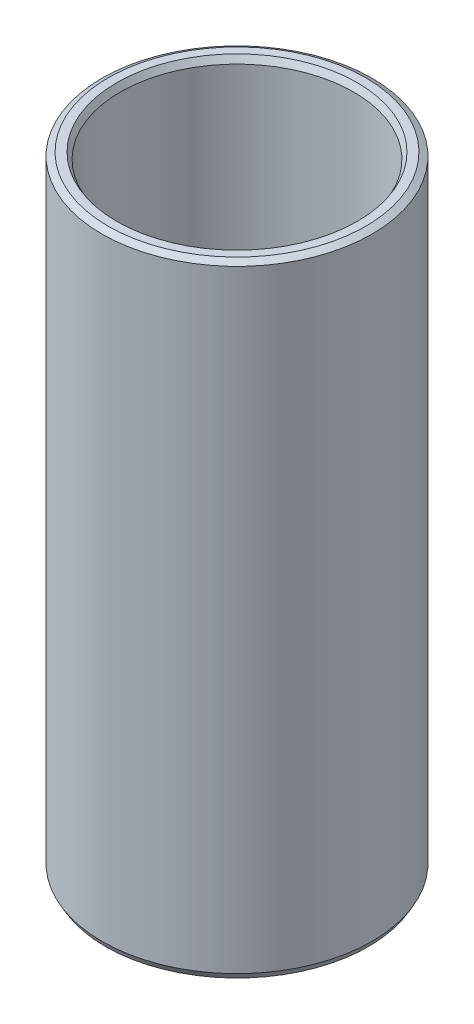
from build123d import *
from OCP.BRepFilletAPI import BRepFilletAPI_MakeChamfer

# Parameters (mm, degrees)
SKETCH1_R           = 47.5
BOSS_EXTRUDE1_DEPTH = 218.951031633
SKETCH2_R           = 41.034381125
CUT_EXTRUDE1_DEPTH  = 230.024134652
CHAMFER1_SIZE       = 1.256157061
CHAMFER1_SIZE2      = 2.228060438


with BuildPart() as part:
    # Sketch1 → Boss-Extrude1 (new body)
    with BuildSketch(Plane(origin=(0, 0, 0), x_dir=(1, 0, 0), z_dir=(0, 1, 0))):
        Circle(SKETCH1_R)
    extrude(amount=BOSS_EXTRUDE1_DEPTH)

    # Sketch2 → Cut-Extrude1 (cut, through all)
    with BuildSketch(Plane(origin=(0, 0, 0), x_dir=(1, 0, 0), z_dir=(0, 1, 0))):
        Circle(SKETCH2_R)
    extrude(amount=CUT_EXTRUDE1_DEPTH, mode=Mode.SUBTRACT)

    # Chamfer1: one chamfer whose edges measure the first distance from different faces: ONE call of the kernel's chamfer builder (chamfer() names one face for all edges)
    chamfer1_edges_1 = [part.edges().sort_by_distance(p)[0] for p in [
        (-41.034381125, 218.951031633, 0),
    ]]
    chamfer1_side_1 = [part.faces().sort_by_distance(p)[0] for p in [
        (-46.156497116, 218.951031633, 0),
    ]]
    chamfer1_edges_2 = [part.edges().sort_by_distance(p)[0] for p in [
        (-41.034381125, 0, 0),
    ]]
    chamfer1_side_2 = [part.faces().sort_by_distance(p)[0] for p in [
        (-41.034381125, 109.475515816, 0),
    ]]
    chamfer1_edges_3 = [part.edges().sort_by_distance(p)[0] for p in [
        (-47.5, 0, 0),
    ]]
    chamfer1_side_3 = [part.faces().sort_by_distance(p)[0] for p in [
        (-46.156497116, 0, 0),
    ]]
    chamfer1_edges_4 = [part.edges().sort_by_distance(p)[0] for p in [
        (-47.5, 218.951031633, 0),
    ]]
    chamfer1_side_4 = [part.faces().sort_by_distance(p)[0] for p in [
        (-47.5, 109.475515816, 0),
    ]]
    chamfer1 = BRepFilletAPI_MakeChamfer(part.part.solid().wrapped)
    for e in chamfer1_edges_1:
        chamfer1.Add(CHAMFER1_SIZE, CHAMFER1_SIZE2, e.wrapped, chamfer1_side_1[0].wrapped)  # the first distance lies on this face
    for e in chamfer1_edges_2:
        chamfer1.Add(CHAMFER1_SIZE, CHAMFER1_SIZE2, e.wrapped, chamfer1_side_2[0].wrapped)  # the first distance lies on this face
    for e in chamfer1_edges_3:
        chamfer1.Add(CHAMFER1_SIZE, CHAMFER1_SIZE2, e.wrapped, chamfer1_side_3[0].wrapped)  # the first distance lies on this face
    for e in chamfer1_edges_4:
        chamfer1.Add(CHAMFER1_SIZE, CHAMFER1_SIZE2, e.wrapped, chamfer1_side_4[0].wrapped)  # the first distance lies on this face
    add(Compound.cast(chamfer1.Shape()), mode=Mode.REPLACE)


solid = part.part
